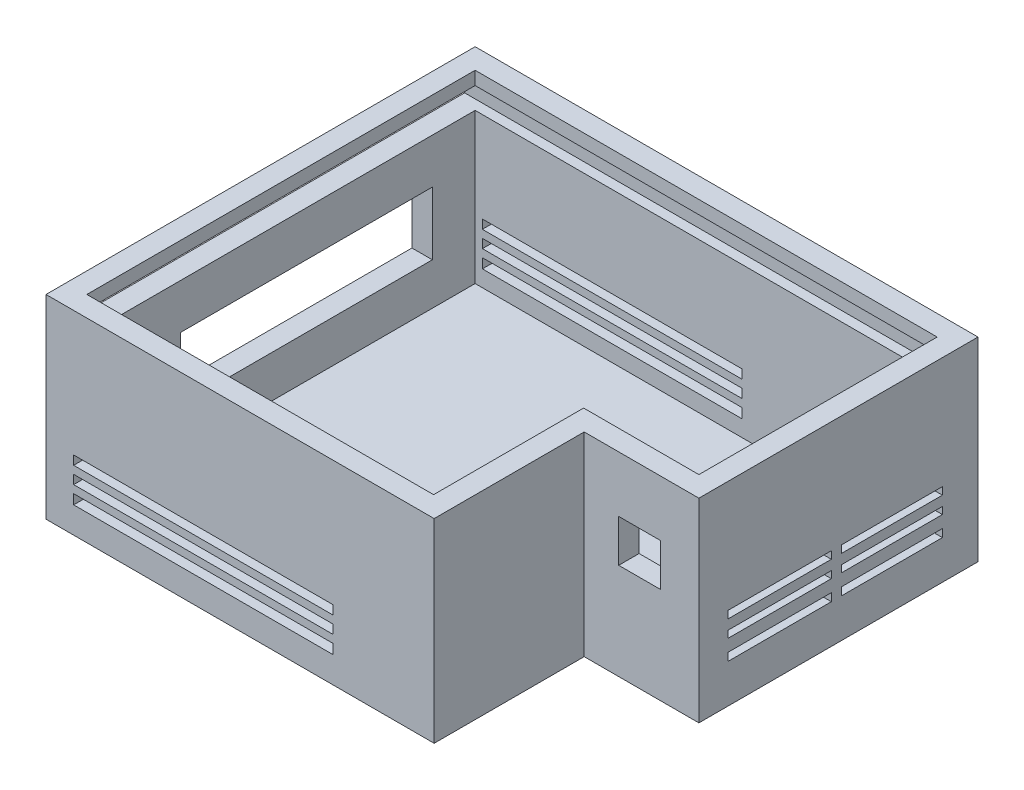
from build123d import *

# Parameters (mm, degrees)
BOSS_EXTRUDE1_DEPTH = 55.88
SKETCH25_W          = 76.2
SKETCH25_H          = 19.05
CUT_EXTRUDE9_DEPTH  = 45
SKETCH26_W          = 30.523269702
SKETCH26_H          = 2.237493103
SKETCH26_W_2        = 31.233113184
SKETCH26_H_2        = 2.373023229
SKETCH26_H_3        = 2.119290111
CUT_EXTRUDE10_DEPTH = 45
SKETCH27_W          = 78.529626093
SKETCH27_H          = 2.934693649
SKETCH27_H_2        = 2.6992147
SKETCH27_H_3        = 2.709324196
CUT_EXTRUDE11_DEPTH = 254
SKETCH23_W          = 12.7
SKETCH23_H          = 12.812800452
CUT_EXTRUDE12_DEPTH = 50.8
SKETCH31_W          = 123.564738067
SKETCH31_H          = 6.504927573
CUT_EXTRUDE13_DEPTH = 113.8
SKETCH34_W          = 2.794
SKETCH34_H          = 6
SKETCH34_W_2        = 3
SKETCH34_H_2        = 6.504927573
CUT_EXTRUDE14_DEPTH = 35.8
SKETCH35_W          = 72.084375
SKETCH35_H          = 6
CUT_EXTRUDE15_DEPTH = 2.8
BOSS_EXTRUDE2_DEPTH = 3


with BuildPart() as part:
    # Sketch1 → Boss-Extrude1 (new body)
    with BuildSketch(Plane(origin=(0, 0, 0), x_dir=(1, 0, 0), z_dir=(0, 1, 0))):
        Polygon((104.775, 6.175), (-6.175, 6.175), (-6.175, -123.65), (104.902, -123.65), (111.252, -123.65), (111.252, -78.259375), (145.95, -78.259375), (145.95, 6.175), align=None)
        Polygon((0, 0), (104.775, 0), (139.775, 0), (139.775, -72.084375), (107.949403386, -72.084375), (104.902, -72.084375), (104.902, -117.475), (0, -117.475), align=None, mode=Mode.SUBTRACT)
    extrude(amount=BOSS_EXTRUDE1_DEPTH)

    # Sketch25 → Cut-Extrude9 (cut)
    with BuildSketch(Plane.ZY.offset(6.175)):
        with Locations((51.04554729, 22.225)):
            Rectangle(SKETCH25_W, SKETCH25_H)
    extrude(amount=-CUT_EXTRUDE9_DEPTH, mode=Mode.SUBTRACT)

    # Sketch26 → Cut-Extrude10 (cut)
    with BuildSketch(Plane(origin=(145.95, 0, 0), x_dir=(0, 0, -1), z_dir=(1, 0, 0))):
        with Locations((-19.859686164, 20.955094684)):
            Rectangle(SKETCH26_W, SKETCH26_H)
        with Locations((-53.813866027, 9.901663162)):
            Rectangle(SKETCH26_W_2, SKETCH26_H_2)
        with Locations((-19.859686164, 9.901663162)):
            Rectangle(SKETCH26_W, SKETCH26_H_2)
        with Locations((-53.813866027, 15.812585987)):
            Rectangle(SKETCH26_W_2, SKETCH26_H_3)
        with Locations((-19.859686164, 15.812585987)):
            Rectangle(SKETCH26_W, SKETCH26_H_3)
        with Locations((-53.813866027, 20.955094684)):
            Rectangle(SKETCH26_W_2, SKETCH26_H)
    extrude(amount=-CUT_EXTRUDE10_DEPTH, mode=Mode.SUBTRACT)

    # Sketch27 → Cut-Extrude11 (cut)
    with BuildSketch(Plane(origin=(0, 0, -6.175), x_dir=(-1, 0, 0), z_dir=(0, 0, -1))):
        with Locations((-41.456138019, 6.407058623)):
            Rectangle(SKETCH27_W, SKETCH27_H)
        with Locations((-41.456138019, 11.590217132)):
            Rectangle(SKETCH27_W, SKETCH27_H_2)
        with Locations((-41.456138019, 16.660698202)):
            Rectangle(SKETCH27_W, SKETCH27_H_3)
    extrude(amount=-CUT_EXTRUDE11_DEPTH, mode=Mode.SUBTRACT)

    # Sketch23 → Cut-Extrude12 (cut)
    with BuildSketch(Plane.XY.offset(78.259375)):
        with Locations((128.04011729, 32.5625418)):
            Rectangle(SKETCH23_W, SKETCH23_H)
    extrude(amount=-CUT_EXTRUDE12_DEPTH, mode=Mode.SUBTRACT)

    # Sketch31 → Cut-Extrude13 (cut)
    with BuildSketch(Plane.ZY.offset(6.175)):
        with Locations((58.782369034, 48.622896581)):
            Rectangle(SKETCH31_W, SKETCH31_H)
    extrude(amount=-CUT_EXTRUDE13_DEPTH, mode=Mode.SUBTRACT)

    # Sketch34 → Cut-Extrude14 (cut)
    with BuildSketch(Plane.ZY.offset(-107.625)):
        with Locations((73.481375, 48.370432794)):
            Rectangle(SKETCH34_W, SKETCH34_H)
        with Locations((-1.5, 48.622896581)):
            Rectangle(SKETCH34_W_2, SKETCH34_H_2)
    extrude(amount=-CUT_EXTRUDE14_DEPTH, mode=Mode.SUBTRACT)

    # Sketch35 → Cut-Extrude15 (cut)
    with BuildSketch(Plane.ZY.offset(-139.775)):
        with Locations((36.0421875, 48.370432794)):
            Rectangle(SKETCH35_W, SKETCH35_H)
    extrude(amount=-CUT_EXTRUDE15_DEPTH, mode=Mode.SUBTRACT)

    # Sketch36 → Boss-Extrude2 (add)
    with BuildSketch(Plane.XZ):
        Polygon((111.252, 78.259375), (111.252, 123.65), (-6.175, 123.65), (-6.175, -6.175), (145.95, -6.175), (145.95, 78.259375), align=None)
    extrude(amount=BOSS_EXTRUDE2_DEPTH)


solid = part.part
